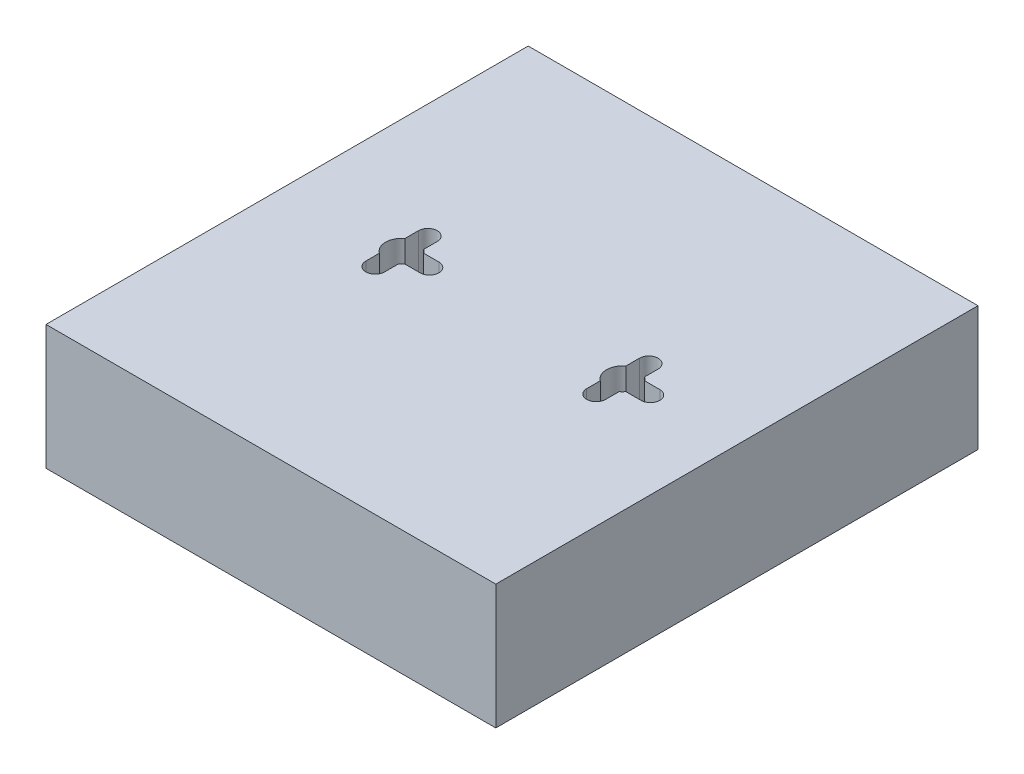
from build123d import *

# Parameters (mm, degrees)
SKETCH1_W           = 94.2086
SKETCH1_H           = 101
BOSS_EXTRUDE1_DEPTH = 26.1
SKETCH2_R           = 5.461
BOSS_EXTRUDE2_DEPTH = 2.54


with BuildPart() as part:
    # Sketch1 → Boss-Extrude1 (new body)
    with BuildSketch(Plane(origin=(0, 0, 0), x_dir=(1, 0, 0), z_dir=(0, 1, 0))):
        with Locations((47.1043, 50.5)):
            Rectangle(SKETCH1_W, SKETCH1_H)
        with BuildLine():
            ThreePointArc((22, 56.0118), (23.9685, 57.9803), (25.937, 56.0118))
            Line((25.937, 56.0118), (25.937, 53.182647668))
            ThreePointArc((25.937, 53.182647668), (26.321327104, 52.852827104), (26.651147668, 52.4685))
            Line((26.651147668, 52.4685), (29.8232, 52.4685))
            ThreePointArc((29.8232, 52.4685), (31.7917, 50.5), (29.8232, 48.5315))
            Line((29.8232, 48.5315), (26.651147668, 48.5315))
            ThreePointArc((26.651147668, 48.5315), (26.321327104, 48.147172896), (25.937, 47.817352332))
            Line((25.937, 47.817352332), (25.937, 44.9882))
            ThreePointArc((25.937, 44.9882), (23.9685, 43.0197), (22, 44.9882))
            Line((22, 44.9882), (22, 47.817352332))
            ThreePointArc((22, 47.817352332), (20.6411, 50.5), (22, 53.182647668))
            Line((22, 53.182647668), (22, 56.0118))
        make_face(mode=Mode.SUBTRACT)
        with BuildLine():
            ThreePointArc((68.2716, 56.0118), (70.2401, 57.9803), (72.2086, 56.0118))
            Line((72.2086, 56.0118), (72.2086, 53.182647668))
            ThreePointArc((72.2086, 53.182647668), (72.592927104, 52.852827104), (72.922747668, 52.4685))
            Line((72.922747668, 52.4685), (76.0948, 52.4685))
            ThreePointArc((76.0948, 52.4685), (78.0633, 50.5), (76.0948, 48.5315))
            Line((76.0948, 48.5315), (72.922747668, 48.5315))
            ThreePointArc((72.922747668, 48.5315), (72.592927104, 48.147172896), (72.2086, 47.817352332))
            Line((72.2086, 47.817352332), (72.2086, 44.9882))
            ThreePointArc((72.2086, 44.9882), (70.2401, 43.0197), (68.2716, 44.9882))
            Line((68.2716, 44.9882), (68.2716, 47.817352332))
            ThreePointArc((68.2716, 47.817352332), (66.9127, 50.5), (68.2716, 53.182647668))
            Line((68.2716, 53.182647668), (68.2716, 56.0118))
        make_face(mode=Mode.SUBTRACT)
    extrude(amount=BOSS_EXTRUDE1_DEPTH)

    # Sketch2 → Boss-Extrude2 (add)
    with BuildSketch(Plane.XZ):
        with Locations((11.938, -20.32)):
            Circle(SKETCH2_R)
        with Locations((82.2706, -20.32)):
            Circle(SKETCH2_R)
        with Locations((11.938, -85.76)):
            Circle(SKETCH2_R)
        with Locations((82.2706, -85.76)):
            Circle(SKETCH2_R)
    extrude(amount=BOSS_EXTRUDE2_DEPTH)


solid = part.part
